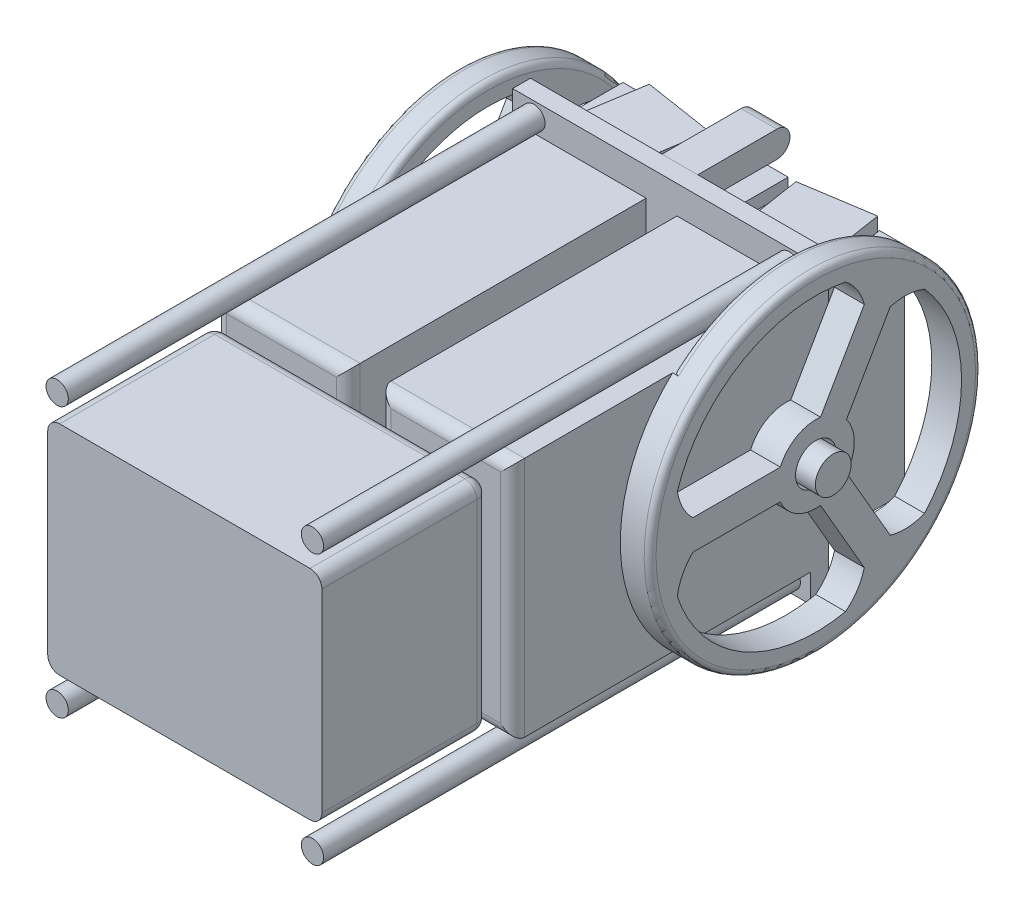
from build123d import *

# Parameters (mm, degrees)
SKETCH_1_W              = 50
SKETCH_1_H              = 50
EXTRUDE_2_DEPTH         = 3
SKETCH_3_W              = 22.412639672
SKETCH_3_H              = 40.541466558
EXTRUDE_10_DEPTH        = 50
EXTRUDE_10_2_DEPTH      = 50
SKETCH_5_R              = 27.803617469
SKETCH_5_R_2            = 3.406987868
EXTRUDE_13_DEPTH        = 5
SKETCH_9_R              = 3
EXTRUDE_14_DEPTH        = 8
SKETCH_10_R             = 3.003896493
EXTRUDE_15_DEPTH        = 8
FILLET_1_R              = 1
CUT_EXTRUDE_1_DEPTH     = 5
FILLET_2_R              = 2
SKETCH_13_R             = 1.872819544
EXTRUDE_16_DEPTH        = 80
EXTRUDE_17_DEPTH        = 20
EXTRUDE_17_DEPTH_BACK   = 20
SKETCH_14_W             = 12
SKETCH_14_H             = 10
EXTRUDE_17_2_DEPTH      = 20
EXTRUDE_17_2_DEPTH_BACK = 20
EXTRUDE_17_3_DEPTH      = 20
EXTRUDE_17_3_DEPTH_BACK = 20
EXTRUDE_18_DEPTH        = 18
EXTRUDE_18_DEPTH_BACK   = 18
SKETCH_16_W             = 46
SKETCH_16_H             = 36.541466558
EXTRUDE_19_DEPTH        = 28
FILLET_3_R              = 2
EXTRUDE_20_DEPTH        = 3


with BuildPart() as part:
    # 草图1 → 凸台-拉伸2 (new body)
    with BuildSketch(Plane.XY):
        Rectangle(SKETCH_1_W, SKETCH_1_H)
    extrude(amount=EXTRUDE_2_DEPTH)



with BuildPart() as body_2:
    # 草图3 → 凸台-拉伸10 (new body)
    with BuildSketch(Plane.XY.offset(3)):
        with Locations((-13.793680164, 0)):
            Rectangle(SKETCH_3_W, SKETCH_3_H)
    extrude(amount=EXTRUDE_10_DEPTH)


with BuildPart() as body_3:
    # 草图3 → Extrude 10 2 (new body)
    with BuildSketch(Plane.XY.offset(3)):
        with Locations((13.793680164, 0)):
            Rectangle(SKETCH_3_W, SKETCH_3_H)
    extrude(amount=EXTRUDE_10_2_DEPTH)



with BuildPart() as part_1:
    add(part.part)

    add(body_2.part)  # 凸台-拉伸13 merges body 2
    # 草图5 → 凸台-拉伸13 (add)
    with BuildSketch(Plane.ZY.offset(25)):
        with Locations((7.124588933, 0)):
            Circle(SKETCH_5_R)
        with Locations((7.124588933, 0)):
            Circle(SKETCH_5_R_2, mode=Mode.SUBTRACT)
    extrude_13 = extrude(amount=EXTRUDE_13_DEPTH)

    # 草图9 → 凸台-拉伸14 (add)
    with BuildSketch(Plane.ZY.offset(25)):
        with Locations((7.124588933, 0)):
            Circle(SKETCH_9_R)
    extrude(amount=EXTRUDE_14_DEPTH)

    # 镜向6: 凸台-拉伸13 across plane
    add(extrude_13.mirror(Plane(origin=(0, 0, 0), x_dir=(0, 0, 1), z_dir=(1, 0, 0))))


with BuildPart() as body_3_1:
    add(body_3.part)

    add(part_1.part)  # 凸台-拉伸15 merges part
    # 草图10 → 凸台-拉伸15 (add)
    with BuildSketch(Plane(origin=(25, 0, 0), x_dir=(0, 0, -1), z_dir=(1, 0, 0))):
        with Locations((-7.194411004, 0)):
            Circle(SKETCH_10_R)
    extrude(amount=EXTRUDE_15_DEPTH)

    # 圆角1
    fillet_1_edges = [body_3_1.edges().sort_by_distance(p)[0] for p in [
        (-30, 0, -20.679028537),
        (-25, 0, -20.679028537),
        (25, 0, -20.679028537),
        (30, 0, -20.679028537),
    ]]
    fillet(fillet_1_edges, radius=FILLET_1_R)

    # 草图12 → 切除-拉伸1 (cut)
    with BuildSketch(Plane(origin=(30, 0, 0), x_dir=(0, 0, -1), z_dir=(1, 0, 0))):
        with BuildLine():
            Line((1.013872624, 19.124472743), (-6.327795379, 6.40833075))
            ThreePointArc((-6.327795379, 6.40833075), (-10.353427074, 5.59251171), (-13.072762935, 2.514121916))
            Line((-13.072762935, 2.514121916), (-27.756098941, 2.514121916))
            ThreePointArc((-27.756098941, 2.514121916), (-29.479399276, 4.867617279), (-30.357659922, 7.64922881))
            ThreePointArc((-30.357659922, 7.64922881), (-19.35453465, 21.182887356), (-2.132479907, 23.945044089))
            ThreePointArc((-2.132479907, 23.945044089), (-0.162663981, 21.793642294), (1.013872624, 19.124472743))
        make_face()
        with BuildLine():
            Line((-27.756098941, -2.514121916), (-13.072762935, -2.514121916))
            ThreePointArc((-13.072762935, -2.514121916), (-10.353427074, -5.59251171), (-6.327795379, -6.40833075))
            Line((-6.327795379, -6.40833075), (1.013872624, -19.124472743))
            ThreePointArc((1.013872624, -19.124472743), (-0.162663981, -21.793642294), (-2.132479907, -23.945044089))
            ThreePointArc((-2.132479907, -23.945044089), (-19.35453465, -21.182887356), (-30.357659922, -7.64922881))
            ThreePointArc((-30.357659922, -7.64922881), (-29.479399276, -4.867617279), (-27.756098941, -2.514121916))
        make_face()
        with BuildLine():
            Line((5.368459518, 16.610350828), (-1.973208485, 3.894208834))
            ThreePointArc((-1.973208485, 3.894208834), (-0.666912651, 0), (-1.973208485, -3.894208834))
            Line((-1.973208485, -3.894208834), (5.368459518, -16.610350828))
            ThreePointArc((5.368459518, -16.610350828), (8.268296458, -16.926025015), (11.116373031, -16.29581528))
            ThreePointArc((11.116373031, -16.29581528), (17.335302501, 0), (11.116373031, 16.29581528))
            ThreePointArc((11.116373031, 16.29581528), (8.268296458, 16.926025015), (5.368459518, 16.610350828))
        make_face()
    cut_extrude_1 = extrude(amount=-CUT_EXTRUDE_1_DEPTH, mode=Mode.SUBTRACT)

    # 镜向7: 切除-拉伸1 across plane
    add(cut_extrude_1.mirror(Plane(origin=(0, 0, 0), x_dir=(0, 0, 1), z_dir=(1, 0, 0))), mode=Mode.SUBTRACT)

    # 圆角2
    fillet_2_edges = [body_3_1.edges().sort_by_distance(p)[0] for p in [
        (13.793680164, 20.270733279, 53),
        (25, 0, 53),
        (13.793680164, -20.270733279, 53),
        (2.587360328, 0, 53),
        (-2.587360328, 0, 53),
        (-13.793680164, 20.270733279, 53),
        (-25, 0, 53),
        (-13.793680164, -20.270733279, 53),
    ]]
    fillet(fillet_2_edges, radius=FILLET_2_R)

    # 草图13 → 凸台-拉伸16 (add)
    with BuildSketch(Plane.XY.offset(3)):
        with Locations((21.418219599, 22.626640549)):
            Circle(SKETCH_13_R)
        with Locations((-21.418219599, 22.626640549)):
            Circle(SKETCH_13_R)
        with Locations((-21.418219599, -22.626640549)):
            Circle(SKETCH_13_R)
        with Locations((21.418219599, -22.626640549)):
            Circle(SKETCH_13_R)
    extrude(amount=EXTRUDE_16_DEPTH)

    # 草图17 → 凸台-拉伸20 (add, symmetric)
    with BuildSketch(Plane(origin=(0, 0, 0), x_dir=(0, 0, -1), z_dir=(1, 0, 0))):
        with BuildLine():
            Line((13.336627081, 24.928980402), (0, 24.928980402))
            Line((0, 24.928980402), (0, 20.518156825))
            Line((0, 20.518156825), (13.336627081, 20.518156825))
            ThreePointArc((13.336627081, 20.518156825), (15.54203887, 22.723568614), (13.336627081, 24.928980402))
        make_face()
    extrude_20 = extrude(amount=EXTRUDE_20_DEPTH, both=True)

    # 镜向10: 凸台-拉伸20 across plane
    add(extrude_20.mirror(Plane.ZX))


with BuildPart() as body_2_2:
    # 草图14 → 凸台-拉伸17 (new, two sides: drawn at the far end of the back side and taken through both)
    with BuildSketch(Plane(origin=(0, 0, 0), x_dir=(1, 0, 0), z_dir=(0, 1, 0)).offset(-EXTRUDE_17_DEPTH_BACK)):
        with Locations((0, 7.247333393)):
            Rectangle(SKETCH_14_W, SKETCH_14_H)
    extrude(amount=EXTRUDE_17_DEPTH + EXTRUDE_17_DEPTH_BACK)


with BuildPart() as body_3_2:
    # 草图14 → Extrude 17 2 (new, two sides: drawn at the far end of the back side and taken through both)
    with BuildSketch(Plane(origin=(0, 0, 0), x_dir=(1, 0, 0), z_dir=(0, 1, 0)).offset(-EXTRUDE_17_2_DEPTH_BACK)):
        Polygon((7.303024071, 12.247333393), (19.159020849, 14.100800526), (20.703576793, 4.220803211), (8.847580015, 2.367336078), align=None)
    extrude(amount=EXTRUDE_17_2_DEPTH + EXTRUDE_17_2_DEPTH_BACK)


with BuildPart() as body_4:
    # 草图14 → Extrude 17 3 (new, two sides: drawn at the far end of the back side and taken through both)
    with BuildSketch(Plane(origin=(0, 0, 0), x_dir=(1, 0, 0), z_dir=(0, 1, 0)).offset(-EXTRUDE_17_3_DEPTH_BACK)):
        Polygon((-19.159020849, 14.100800526), (-20.703576793, 4.220803211), (-8.847580015, 2.367336078), (-7.303024071, 12.247333393), align=None)
    extrude(amount=EXTRUDE_17_3_DEPTH + EXTRUDE_17_3_DEPTH_BACK)


with BuildPart() as body_5:
    # 草图15 → 凸台-拉伸18 (new, two sides: drawn at the far end of the back side and taken through both)
    with BuildSketch(Plane(origin=(0, 0, 0), x_dir=(1, 0, 0), z_dir=(0, 1, 0)).offset(-EXTRUDE_18_DEPTH_BACK)):
        Polygon((-23.633410333, 0), (23.633410333, 0), (23.633410333, 2.065960129), (23.633410333, 14.145883526), (19.408006921, 14.145883526), (21.098550551, 3.889336494), (8.649002602, 2.065960129), (7.158137739, 12.245204497), (6.163254732, 12.245204497), (6.163254732, 2.065960129), (-6.163254732, 2.065960129), (-6.163254732, 12.245204497), (-7.158137739, 12.245204497), (-8.649002602, 2.065960129), (-21.098550551, 3.889336494), (-19.408006921, 14.145883526), (-23.633410333, 14.145883526), (-23.633410333, 2.065960129), align=None)
    extrude(amount=EXTRUDE_18_DEPTH + EXTRUDE_18_DEPTH_BACK)


with BuildPart() as body_6:
    # 草图16 → 凸台-拉伸19 (new body)
    with BuildSketch(Plane.XY.offset(83)):
        Rectangle(SKETCH_16_W, SKETCH_16_H)
    extrude(amount=-EXTRUDE_19_DEPTH)

    # 圆角3
    fillet_3_edges = [body_6.edges().sort_by_distance(p)[0] for p in [
        (-23, 18.270733279, 69),
        (23, 18.270733279, 69),
        (23, 0, 55),
        (23, -18.270733279, 69),
        (0, -18.270733279, 55),
        (-23, -18.270733279, 69),
        (-23, 0, 55),
        (0, 18.270733279, 55),
    ]]
    fillet(fillet_3_edges, radius=FILLET_3_R)


solid = Compound([body_3_1.part, body_2_2.part, body_3_2.part, body_4.part, body_5.part, body_6.part])
